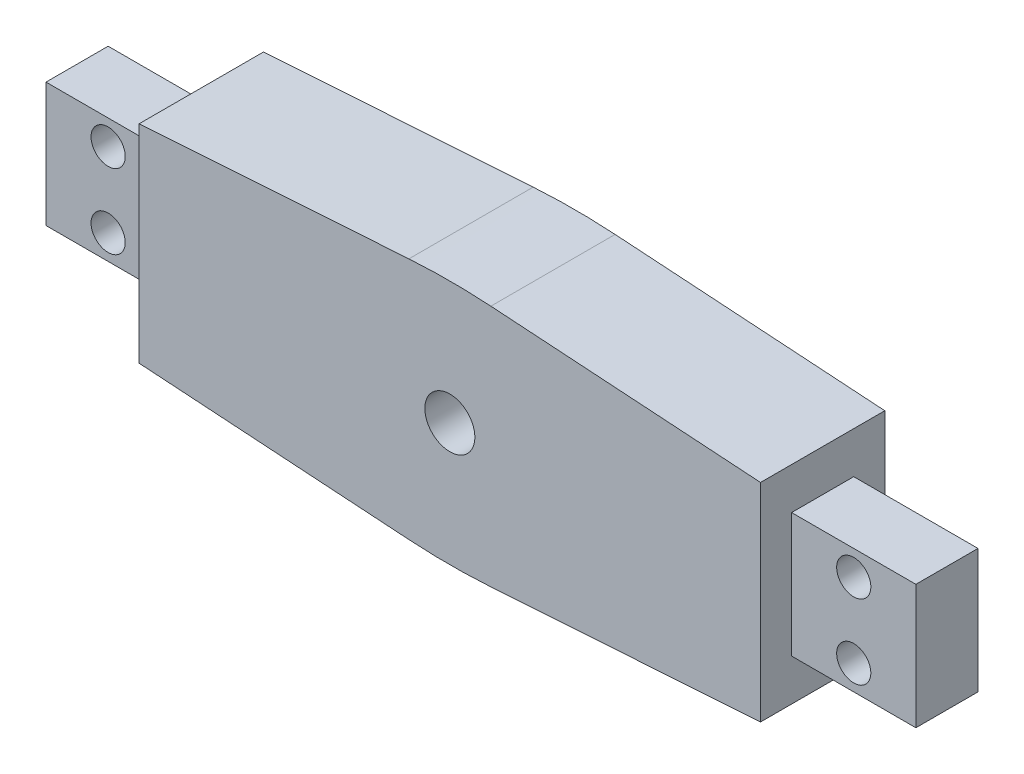
from build123d import *

# Parameters (mm, degrees)
SKETCH1_R           = 4.025
BOSS_EXTRUDE1_DEPTH = 20
FILLET1_R           = 100
SKETCH2_W           = 10
SKETCH2_H           = 20
BOSS_EXTRUDE2_DEPTH = 20
SKETCH3_R           = 2.75
CUT_EXTRUDE1_DEPTH  = 75.271947786


with BuildPart() as part:
    # Sketch1 → Boss-Extrude1 (new body)
    with BuildSketch(Plane.XY):
        Polygon((50, 16.695671227), (50, -16.695671227), (0, -20), (-50, -16.695671227), (-50, 16.695671227), (0, 20), align=None)
        Circle(SKETCH1_R, mode=Mode.SUBTRACT)
    extrude(amount=BOSS_EXTRUDE1_DEPTH)

    # Fillet1
    fillet1_edges = [part.edges().sort_by_distance(p)[0] for p in [
        (0, 20, 10),
        (0, -20, 10),
    ]]
    fillet(fillet1_edges, radius=FILLET1_R)

    # Sketch2 → Boss-Extrude2 (add)
    with BuildSketch(Plane(origin=(50, 0, 0), x_dir=(0, 0, -1), z_dir=(1, 0, 0))):
        with Locations((-10, 0)):
            Rectangle(SKETCH2_W, SKETCH2_H)
    boss_extrude2 = extrude(amount=BOSS_EXTRUDE2_DEPTH)

    # Mirror1: Boss-Extrude2 across plane
    add(boss_extrude2.mirror(Plane(origin=(0, 0, 0), x_dir=(0, 0, 1), z_dir=(1, 0, 0))))

    # Sketch3 → Cut-Extrude1 (cut, through all)
    with BuildSketch(Plane(origin=(0, 0, 5), x_dir=(-1, 0, 0), z_dir=(0, 0, -1))):
        with Locations((60, -6)):
            Circle(SKETCH3_R)
        with Locations((60, 6)):
            Circle(SKETCH3_R)
        with Locations((-60, -6)):
            Circle(SKETCH3_R)
        with Locations((-60, 6)):
            Circle(SKETCH3_R)
    extrude(amount=-CUT_EXTRUDE1_DEPTH, mode=Mode.SUBTRACT)


solid = part.part
